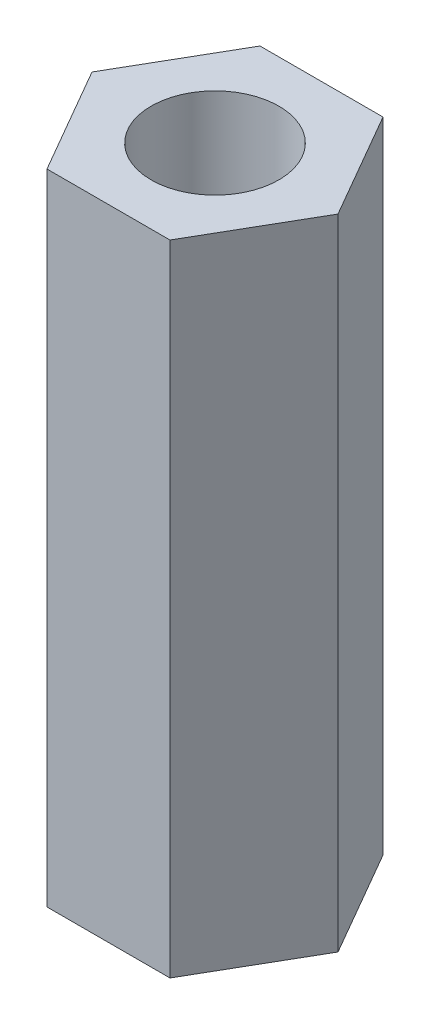
from build123d import *

# Parameters (mm, degrees)
CROQUIS1_R              = 1.5
SALIENTE_EXTRUIR1_DEPTH = 6
SKETCH_1_R              = 1.5
EXTRUDE_1_DEPTH         = 3


with BuildPart() as part:
    # Croquis1 → Saliente-Extruir1 (new, symmetric)
    with BuildSketch(Plane(origin=(0, 0, 0), x_dir=(1, 0, 0), z_dir=(0, 1, 0))):
        Polygon((1.443375673, -2.5), (2.886751346, 0), (1.443375673, 2.5), (-1.443375673, 2.5), (-2.886751346, 0), (-1.443375673, -2.5), align=None)
        Circle(CROQUIS1_R, mode=Mode.SUBTRACT)
    extrude(amount=SALIENTE_EXTRUIR1_DEPTH, both=True)

    # 草图1 → 凸台-拉伸1 (add)
    with BuildSketch(Plane(origin=(0, 6, 0), x_dir=(1, 0, 0), z_dir=(0, 1, 0))):
        Polygon((-1.443375673, -2.5), (1.443375673, -2.5), (2.886751346, 0), (1.443375673, 2.5), (-1.443375673, 2.5), (-2.886751346, 0), align=None)
        Circle(SKETCH_1_R, mode=Mode.SUBTRACT)
    extrude(amount=EXTRUDE_1_DEPTH)


solid = part.part
